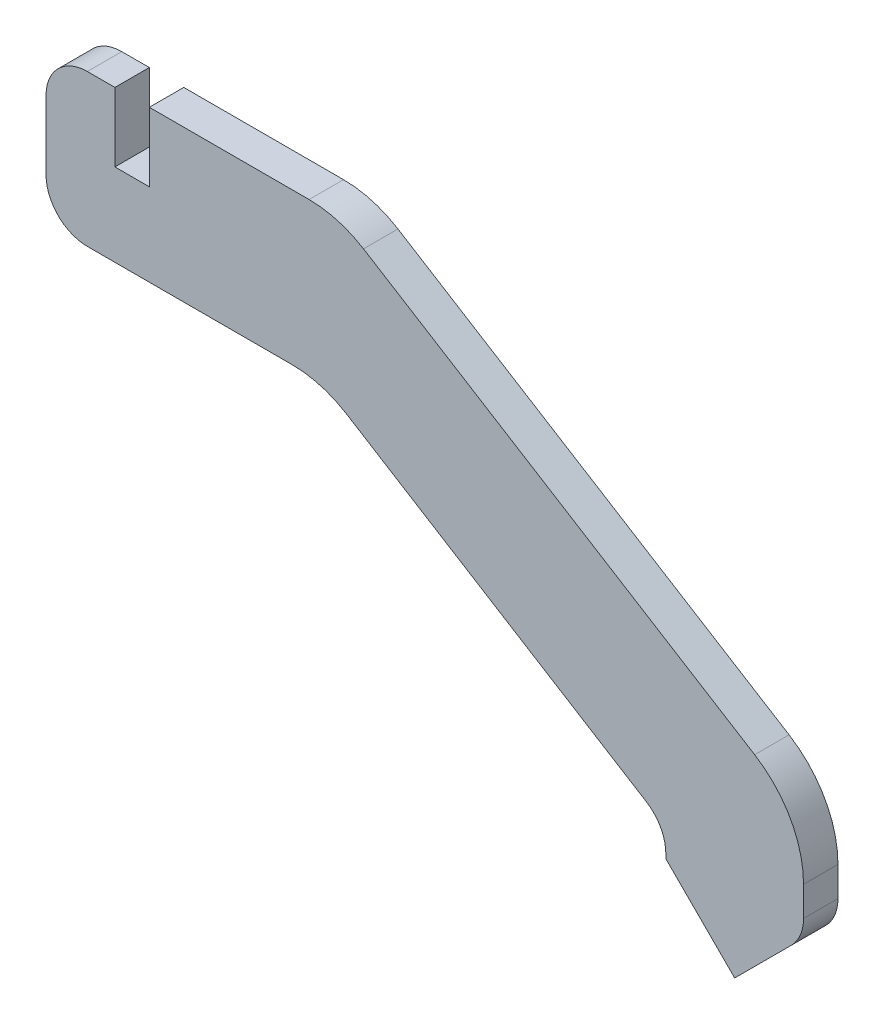
from build123d import *

# Parameters (mm, degrees)
BOSS_EXTRUDE1_DEPTH = 0.125
FILLET1_R           = 0.3
FILLET2_R           = 0.75


with BuildPart() as part:
    # frame_outline → Boss-Extrude1 (new, symmetric)
    with BuildSketch(Plane.XY):
        Polygon((0, 0), (0, 1.1), (0.5, 1.1), (0.5, 0.6), (0.75, 0.6), (0.75, 1.1), (2.123556914, 1.1), (5.5, -0.993394714), (5.5, -1.75), (5, -2.25), (4.5, -1.75), (4.5, -1.55), (2, 0), align=None)
    extrude(amount=BOSS_EXTRUDE1_DEPTH, both=True)

    # Fillet1
    fillet1_edges = [part.edges().sort_by_distance(p)[0] for p in [
        (5.5, -1.75, 0),
        (0, 1.1, 0),
        (4.5, -1.55, 0),
        (0, 0, 0),
    ]]
    fillet(fillet1_edges, radius=FILLET1_R)

    # Fillet2
    fillet2_edges = [part.edges().sort_by_distance(p)[0] for p in [
        (5.5, -0.993394714, 0),
        (2.123556914, 1.1, 0),
        (2, 0, 0),
    ]]
    fillet(fillet2_edges, radius=FILLET2_R)


solid = part.part
